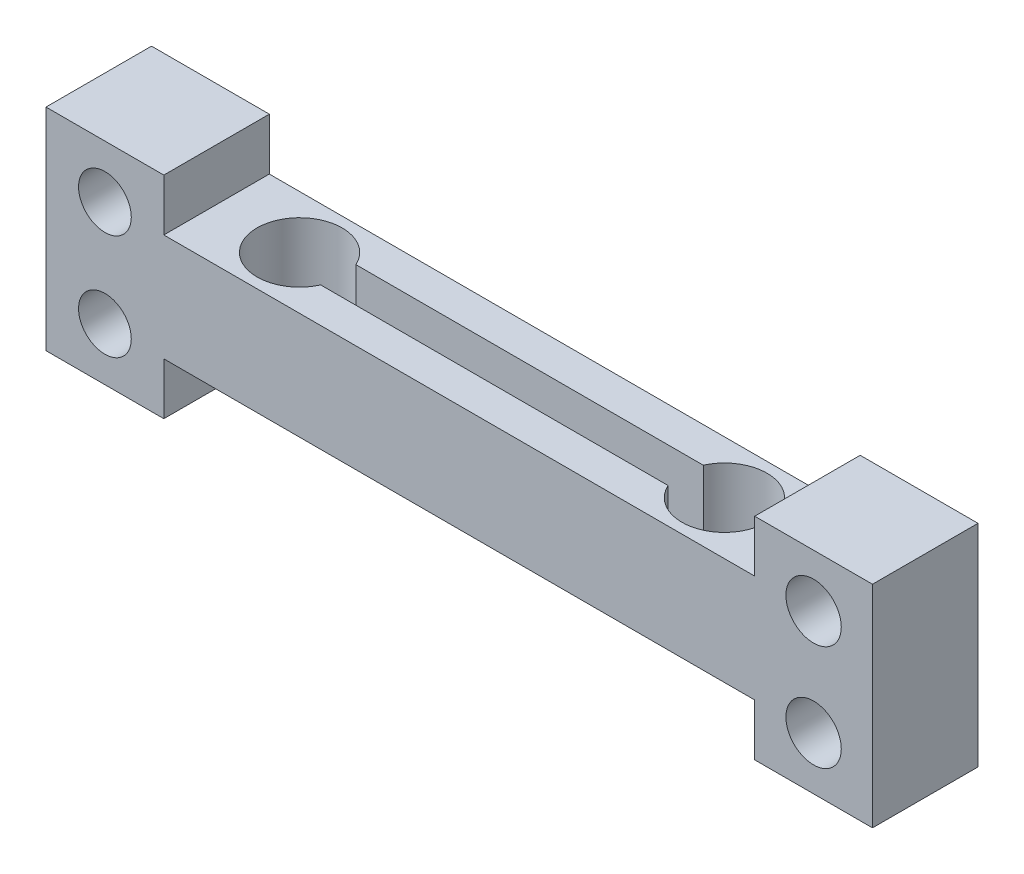
from build123d import *

# Parameters (mm, degrees)
SKETCH1_R               = 1.575
SKETCH1_R_2             = 1.5
BOSS_EXTRUDE1_DEPTH     = 3
CUT_EXTRUDE2_DEPTH      = 45.467094576
CUT_EXTRUDE2_DEPTH_BACK = 45.467094576


with BuildPart() as part:
    # Sketch1 → Boss-Extrude1 (new, symmetric)
    with BuildSketch(Plane.XY):
        Polygon((-3.35, 6), (3.35, 6), (3.35, 3.05), (36.95, 3.05), (36.95, 6), (43.65, 6), (43.65, -6), (36.95, -6), (36.95, -3.05), (3.35, -3.05), (3.35, -6), (-3.35, -6), align=None)
        with Locations((40.3, 3)):
            Circle(SKETCH1_R, mode=Mode.SUBTRACT)
        with Locations((40.3, -3)):
            Circle(SKETCH1_R, mode=Mode.SUBTRACT)
        with Locations((0, 3)):
            Circle(SKETCH1_R_2, mode=Mode.SUBTRACT)
        with Locations((0, -3)):
            Circle(SKETCH1_R_2, mode=Mode.SUBTRACT)
    extrude(amount=BOSS_EXTRUDE1_DEPTH, both=True)

    # Sketch4 → Cut-Extrude2 (cut, two sides: drawn at the far end of the back side and taken through both)
    with BuildSketch(Plane(origin=(0, 0, 3), x_dir=(1, 0, 0), z_dir=(0, 1, 0)).offset(-CUT_EXTRUDE2_DEPTH_BACK)):
        with BuildLine():
            Line((10.273724121, 4), (30.026275879, 4))
            ThreePointArc((30.026275879, 4), (34.65, 3), (30.026275879, 2))
            Line((30.026275879, 2), (10.273724121, 2))
            ThreePointArc((10.273724121, 2), (5.65, 3), (10.273724121, 4))
        make_face()
    extrude(amount=CUT_EXTRUDE2_DEPTH + CUT_EXTRUDE2_DEPTH_BACK, mode=Mode.SUBTRACT)


solid = part.part
